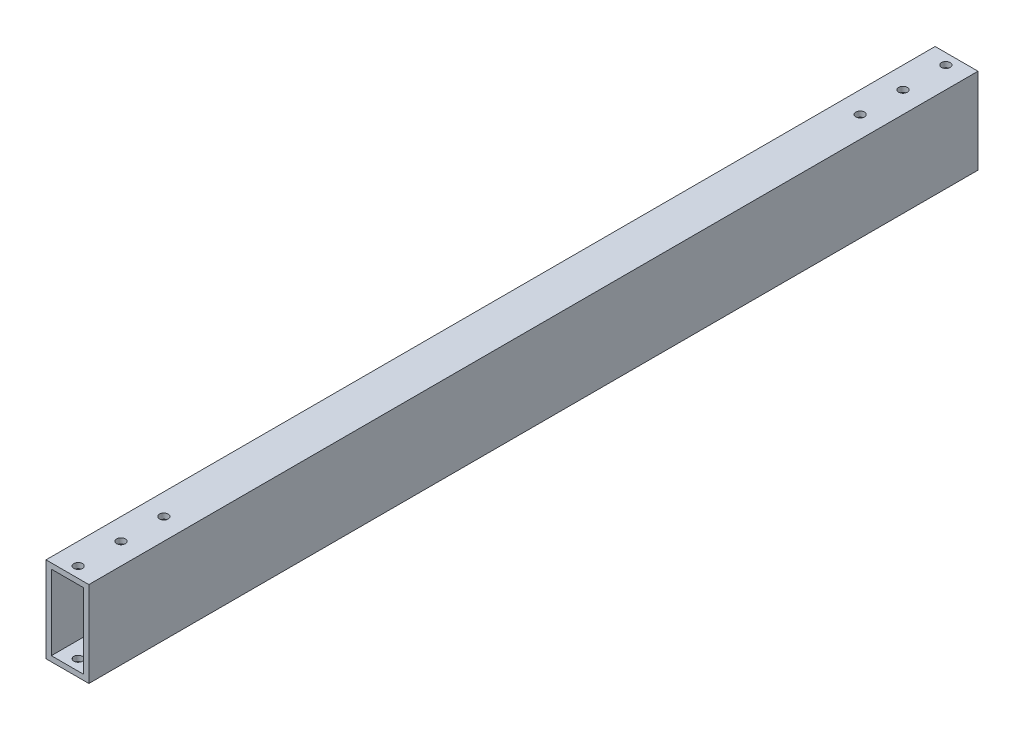
from build123d import *

# Parameters (mm, degrees)
SKETCH1_W              = 25.4
SKETCH1_H              = 50.8
SKETCH1_W_2            = 19.05
SKETCH1_H_2            = 44.45
EXTRUDE_THIN1_DEPTH    = 527.05
F_10_CLEARANCE_HOLE1_D = 5.1054


with BuildPart() as part:
    # Sketch1 → Extrude-Thin1 (new body)
    with BuildSketch(Plane.XY):
        Rectangle(SKETCH1_W, SKETCH1_H)
        Rectangle(SKETCH1_W_2, SKETCH1_H_2, mode=Mode.SUBTRACT)
    extrude(amount=EXTRUDE_THIN1_DEPTH)

    # #10 Clearance Hole1 (through all)
    with Locations(Plane(origin=(0, 25.4, 0), x_dir=(1, 0, 0), z_dir=(0, 1, 0))):
        with Locations((0, -520.7), (0, -495.3), (0, -469.9), (0, -6.35), (0, -31.75), (0, -57.15)):
            Hole(F_10_CLEARANCE_HOLE1_D / 2)


solid = part.part
